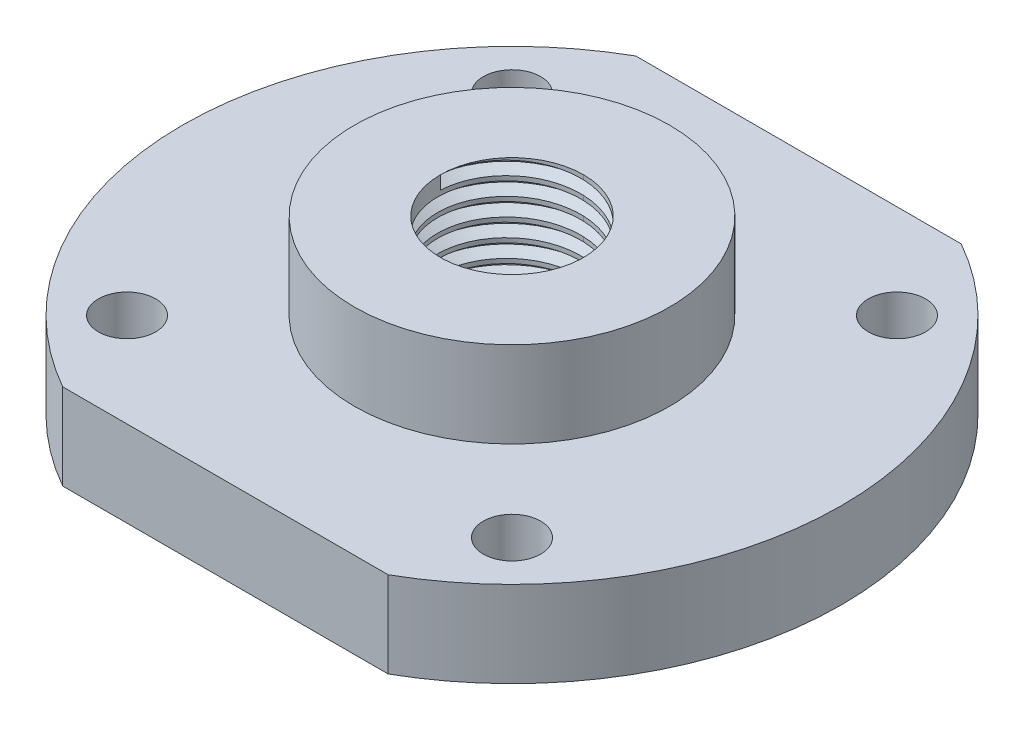
from build123d import *

# Parameters (mm, degrees)
BOSS_EXTRUDE1_DEPTH = 6
BOSS_EXTRUDE2_START = 2
SKETCH3_R           = 15
SKETCH3_R_2         = 5
BOSS_EXTRUDE2_DEPTH = 2
SKETCH4_R           = 11
SKETCH4_R_2         = 5
BOSS_EXTRUDE3_DEPTH = 6
THREAD1_PITCH       = 1.25


with BuildPart() as part:
    # Sketch2 → Boss-Extrude1 (new body)
    with BuildSketch(Plane(origin=(0, 0, 0), x_dir=(1, 0, 0), z_dir=(0, 1, 0))):
        with BuildLine():
            ThreePointArc((-11.94834309, 14.772850009), (-6.337028082, 17.91206507), (0, 19))
            Line((0, 19), (0, 20))
            Line((0, 20), (-11.357816692, 20))
            ThreePointArc((-11.357816692, 20), (-23, 0), (-11.357816692, -20))
            Line((-11.357816692, -20), (0, -20))
            Line((0, -20), (0, -19))
            ThreePointArc((0, -19), (-6.337028082, -17.91206507), (-11.94834309, -14.772850009))
            ThreePointArc((-11.94834309, -14.772850009), (-14.849242405, -14.849242405), (-14.772850009, -11.94834309))
            ThreePointArc((-14.772850009, -11.94834309), (-19, 0), (-14.772850009, 11.94834309))
            ThreePointArc((-14.772850009, 11.94834309), (-14.849242405, 14.849242405), (-11.94834309, 14.772850009))
        make_face()
        with BuildLine():
            Line((-11.435028843, 13.435028843), (0, 13.435028843))
            Line((0, 13.435028843), (0, 19))
            ThreePointArc((0, 19), (-6.337028082, 17.91206507), (-11.94834309, 14.772850009))
            ThreePointArc((-11.94834309, 14.772850009), (-11.567761922, 14.151488365), (-11.435028843, 13.435028843))
        make_face()
        with BuildLine():
            ThreePointArc((-14.772850009, -11.94834309), (-14.151488365, -11.567761922), (-13.435028843, -11.435028843))
            Line((-13.435028843, -11.435028843), (-13.435028843, 11.435028843))
            ThreePointArc((-13.435028843, 11.435028843), (-14.151488365, 11.567761922), (-14.772850009, 11.94834309))
            ThreePointArc((-14.772850009, 11.94834309), (-19, 0), (-14.772850009, -11.94834309))
        make_face()
        with BuildLine():
            ThreePointArc((-3.535533906, -3.535533906), (-4.619397663, 1.913417162), (0, 5))
            Line((0, 5), (0, 13.435028843))
            Line((0, 13.435028843), (-11.435028843, 13.435028843))
            ThreePointArc((-11.435028843, 13.435028843), (-12.02081528, 12.02081528), (-13.435028843, 11.435028843))
            Line((-13.435028843, 11.435028843), (-13.435028843, -11.435028843))
            ThreePointArc((-13.435028843, -11.435028843), (-12.669661978, -11.587269778), (-12.02081528, -12.02081528))
            Line((-12.02081528, -12.02081528), (-3.535533906, -3.535533906))
        make_face()
        with BuildLine():
            Line((0, -13.435028843), (0, -5))
            ThreePointArc((0, -5), (-1.913417162, -4.619397663), (-3.535533906, -3.535533906))
            Line((-3.535533906, -3.535533906), (-12.02081528, -12.02081528))
            ThreePointArc((-12.02081528, -12.02081528), (-11.587269778, -12.669661978), (-11.435028843, -13.435028843))
            Line((-11.435028843, -13.435028843), (0, -13.435028843))
        make_face()
        with BuildLine():
            ThreePointArc((5, 0), (3.535533906, -3.535533906), (0, -5))
            Line((0, -5), (0, -13.435028843))
            Line((0, -13.435028843), (11.435028843, -13.435028843))
            ThreePointArc((11.435028843, -13.435028843), (12.02081528, -12.02081528), (13.435028843, -11.435028843))
            Line((13.435028843, -11.435028843), (13.435028843, 11.435028843))
            ThreePointArc((13.435028843, 11.435028843), (12.669661978, 11.587269778), (12.02081528, 12.02081528))
            Line((12.02081528, 12.02081528), (3.535533906, 3.535533906))
            ThreePointArc((3.535533906, 3.535533906), (4.619397663, 1.913417162), (5, 0))
        make_face()
        with BuildLine():
            Line((11.435028843, -13.435028843), (0, -13.435028843))
            Line((0, -13.435028843), (0, -19))
            ThreePointArc((0, -19), (6.337028082, -17.91206507), (11.94834309, -14.772850009))
            ThreePointArc((11.94834309, -14.772850009), (11.567761922, -14.151488365), (11.435028843, -13.435028843))
        make_face()
        with BuildLine():
            Line((0, -19), (0, -13.435028843))
            Line((0, -13.435028843), (-11.435028843, -13.435028843))
            ThreePointArc((-11.435028843, -13.435028843), (-11.567761922, -14.151488365), (-11.94834309, -14.772850009))
            ThreePointArc((-11.94834309, -14.772850009), (-6.337028082, -17.91206507), (0, -19))
        make_face()
        with BuildLine():
            Line((0, 19), (0, 13.435028843))
            Line((0, 13.435028843), (11.435028843, 13.435028843))
            ThreePointArc((11.435028843, 13.435028843), (11.567761922, 14.151488365), (11.94834309, 14.772850009))
            ThreePointArc((11.94834309, 14.772850009), (6.337028082, 17.91206507), (0, 19))
        make_face()
        with BuildLine():
            Line((0, 13.435028843), (0, 5))
            ThreePointArc((0, 5), (1.913417162, 4.619397663), (3.535533906, 3.535533906))
            Line((3.535533906, 3.535533906), (12.02081528, 12.02081528))
            ThreePointArc((12.02081528, 12.02081528), (11.587269778, 12.669661978), (11.435028843, 13.435028843))
            Line((11.435028843, 13.435028843), (0, 13.435028843))
        make_face()
        with BuildLine():
            ThreePointArc((14.772850009, 11.94834309), (14.151488365, 11.567761922), (13.435028843, 11.435028843))
            Line((13.435028843, 11.435028843), (13.435028843, -11.435028843))
            ThreePointArc((13.435028843, -11.435028843), (14.151488365, -11.567761922), (14.772850009, -11.94834309))
            ThreePointArc((14.772850009, -11.94834309), (17.91206507, -6.337028082), (19, 0))
            ThreePointArc((19, 0), (17.91206507, 6.337028082), (14.772850009, 11.94834309))
        make_face()
        with BuildLine():
            Line((0, 20), (0, 19))
            ThreePointArc((0, 19), (6.337028082, 17.91206507), (11.94834309, 14.772850009))
            ThreePointArc((11.94834309, 14.772850009), (14.151488365, 15.302295763), (15.435028843, 13.435028843))
            ThreePointArc((15.435028843, 13.435028843), (15.261999331, 12.621285128), (14.772850009, 11.94834309))
            ThreePointArc((14.772850009, 11.94834309), (17.91206507, 6.337028082), (19, 0))
            ThreePointArc((19, 0), (17.91206507, -6.337028082), (14.772850009, -11.94834309))
            ThreePointArc((14.772850009, -11.94834309), (15.261999331, -12.621285128), (15.435028843, -13.435028843))
            ThreePointArc((15.435028843, -13.435028843), (14.151488365, -15.302295763), (11.94834309, -14.772850009))
            ThreePointArc((11.94834309, -14.772850009), (6.337028082, -17.91206507), (0, -19))
            Line((0, -19), (0, -20))
            Line((0, -20), (11.357816692, -20))
            ThreePointArc((11.357816692, -20), (19.877497125, -11.570873262), (23, 0))
            ThreePointArc((23, 0), (19.877497125, 11.570873262), (11.357816692, 20))
            Line((11.357816692, 20), (0, 20))
        make_face()
    extrude(amount=BOSS_EXTRUDE1_DEPTH)

    # Sketch3 → Boss-Extrude2 (add)
    with BuildSketch(Plane.XZ.offset(BOSS_EXTRUDE2_START)):
        with Locations(Location((0, 0, 0), (0, 0, 90))):
            Circle(SKETCH3_R)
        with Locations(Location((0, 0, 0), (0, 0, 270))):
            Circle(SKETCH3_R_2, mode=Mode.SUBTRACT)
    extrude(amount=-BOSS_EXTRUDE2_DEPTH)

    # Sketch4 → Boss-Extrude3 (add)
    with BuildSketch(Plane(origin=(0, 6, 0), x_dir=(1, 0, 0), z_dir=(0, 1, 0))):
        with Locations(Location((0, 0, 0), (0, 0, 270))):
            Circle(SKETCH4_R)
        with Locations(Location((0, 0, 0), (0, 0, 90))):
            Circle(SKETCH4_R_2, mode=Mode.SUBTRACT)
    extrude(amount=BOSS_EXTRUDE3_DEPTH)

    # Thread1: the profile of Thread Profile1 profile screwed along a right-hand helix of 8 turns, 8 arcs to a turn; built about Z, then put on its axis
    thread1_z = Axis((0, 0, 0), (0, 0, 1))
    thread1_corners = [(4.9997, 0, -0.000173205), (5.676582344, 0, 0.390624998), (5.676582344, 0, 0.546874998), (4.9997, 0, 0.937673202)]
    with BuildLine(mode=Mode.PRIVATE) as thread1_profile:
        Line(thread1_corners[0], thread1_corners[1])
        Line(thread1_corners[1], thread1_corners[2])
        Line(thread1_corners[2], thread1_corners[3])
        Line(thread1_corners[3], thread1_corners[0])
    thread1_cap = Face(thread1_profile.wire())
    thread1_turn_angles = [0, 22.5, 45, 67.5, 90, 112.5, 135, 157.5, 180, 202.5, 225, 247.5, 270, 292.5, 315, 337.5, 360]
    thread1_turn_weights = [1, 0.9238795325112867, 1, 0.9238795325112867, 1, 0.9238795325112867, 1, 0.9238795325112867, 1, 0.9238795325112867, 1, 0.9238795325112867, 1, 0.9238795325112867, 1, 0.9238795325112867, 1]
    thread1_turn_rails = [Edge.make_bspline([Vector(p[0], p[1], 0).rotate(thread1_z, thread1_turn_angles[k]) / thread1_turn_weights[k] + Vector(0, 0, p[2] + THREAD1_PITCH * thread1_turn_angles[k] / 360) for k in range(17)], [0, 0, 0, 1, 1, 2, 2, 3, 3, 4, 4, 5, 5, 6, 6, 7, 7, 8, 8, 8], 2, thread1_turn_weights) for p in thread1_corners]
    thread1_turn_sides = [Face.make_surface_from_curves(thread1_turn_rails[p[0]], thread1_turn_rails[p[1]]) for p in [(0, 1), (1, 2), (2, 3), (3, 0)]]
    thread1 = Plane(origin=(0, 12, 0), x_dir=(-1, 0, 0), z_dir=(0, -1, 0)) * Solid(Shell([*[p.moved(Location((0, 0, THREAD1_PITCH * i))) for i in range(8) for p in thread1_turn_sides], thread1_cap, thread1_cap.rotate(thread1_z, 2880).moved(Location((0, 0, THREAD1_PITCH * 2880 / 360)))]))
    add(thread1, mode=Mode.SUBTRACT)


solid = part.part
